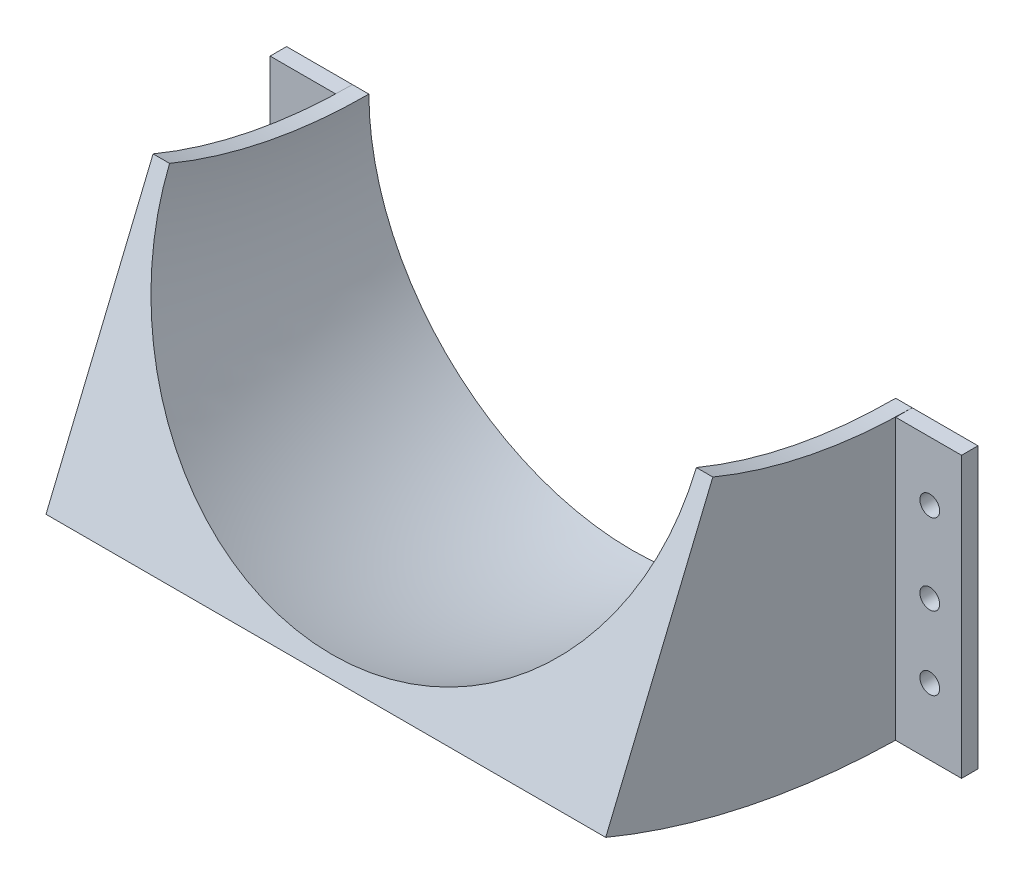
from build123d import *

# Parameters (mm, degrees)
REVOLVE8_ANGLE      = 22.5
SKETCH11_W          = 3.175
SKETCH11_H          = 53.975
BOSS_EXTRUDE3_DEPTH = 12.7
SKETCH10_W          = 3.175
SKETCH10_H          = 53.975
BOSS_EXTRUDE4_DEPTH = 12.7
SKETCH12_R          = 1.905
CUT_EXTRUDE4_DEPTH  = 3.175
SKETCH13_R          = 1.905
CUT_EXTRUDE5_DEPTH  = 3.175


with BuildPart() as part:
    # Sketch9 → Revolve8 (revolve)
    with BuildSketch(Plane.XY):
        with BuildLine():
            Line((50.8, -100.457), (53.975, -100.457))
            Line((53.975, -100.457), (53.975, -154.432))
            Line((53.975, -154.432), (-53.975, -154.432))
            Line((-53.975, -154.432), (-53.975, -100.457))
            Line((-53.975, -100.457), (-50.8, -100.457))
            ThreePointArc((-50.8, -100.457), (0, -151.257), (50.8, -100.457))
        make_face()
    revolve(axis=Axis((-38.048924234, 0, 0), (-1, 0, 0)), revolution_arc=REVOLVE8_ANGLE)

    # Sketch11 → Boss-Extrude3 (add)
    with BuildSketch(Plane.ZY.offset(53.975)):
        with Locations((1.5875, -127.4445)):
            Rectangle(SKETCH11_W, SKETCH11_H)
    extrude(amount=BOSS_EXTRUDE3_DEPTH)

    # Sketch10 → Boss-Extrude4 (add)
    with BuildSketch(Plane(origin=(53.975, 0, 0), x_dir=(0, 0, -1), z_dir=(1, 0, 0))):
        with Locations((-1.5875, -127.4445)):
            Rectangle(SKETCH10_W, SKETCH10_H)
    extrude(amount=BOSS_EXTRUDE4_DEPTH)

    # Sketch12 → Cut-Extrude4 (cut)
    with BuildSketch(Plane.XY.offset(3.175)):
        with Locations((60.550186424, -111.886000657)):
            Circle(SKETCH12_R)
        with Locations((60.550186424, -141.566764633)):
            Circle(SKETCH12_R)
        with Locations((60.550186424, -127.4445)):
            Circle(SKETCH12_R)
    extrude(amount=-CUT_EXTRUDE4_DEPTH, mode=Mode.SUBTRACT)

    # Sketch13 → Cut-Extrude5 (cut)
    with BuildSketch(Plane.XY.offset(3.175)):
        with Locations((-60.754019077, -141.521938379)):
            Circle(SKETCH13_R)
        with Locations((-60.754019077, -112.479497113)):
            Circle(SKETCH13_R)
        with Locations((-60.754019077, -127.4445)):
            Circle(SKETCH13_R)
    extrude(amount=-CUT_EXTRUDE5_DEPTH, mode=Mode.SUBTRACT)


solid = part.part
